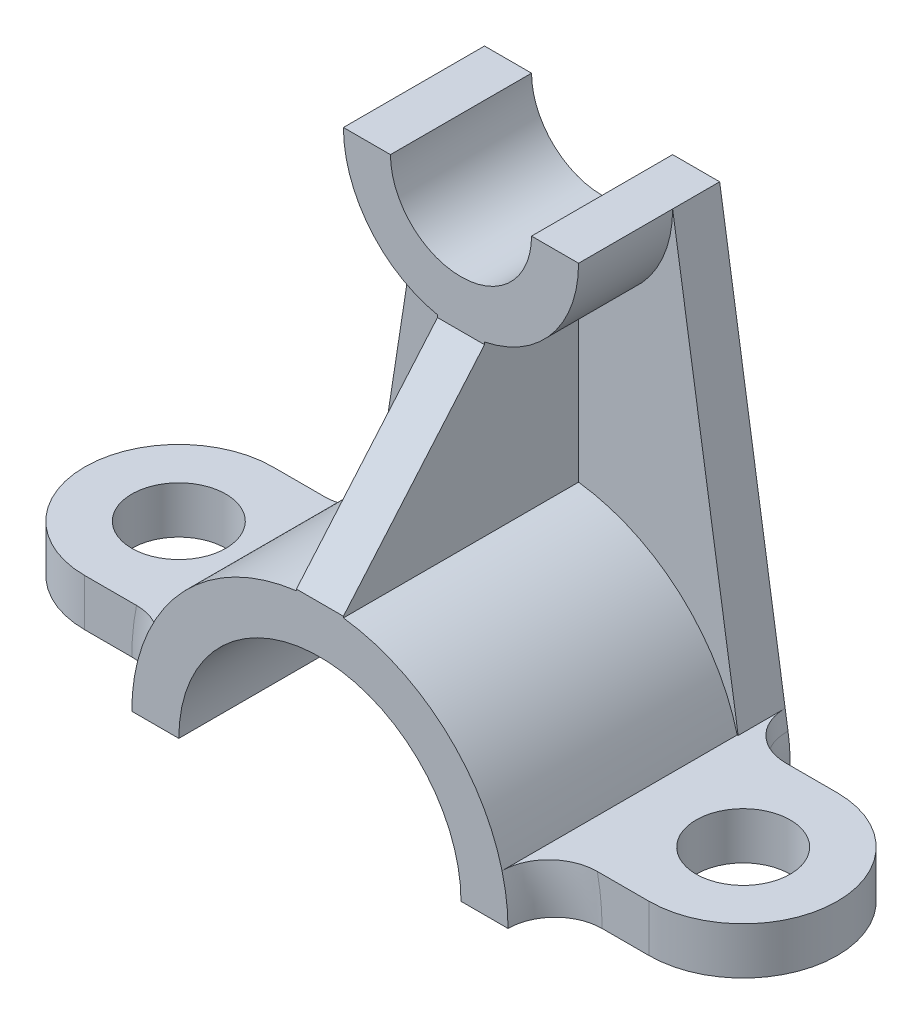
from build123d import *

# Parameters (mm, degrees)
BOSS_EXTRUDE2_DEPTH  = 1524
BOSS_EXTRUDE3_DEPTH  = 762
BOSS_EXTRUDE4_DEPTH  = 254
BOSS_EXTRUDE5_DEPTH  = 254
SKETCH5_R            = 254
CUT_EXTRUDE1_DEPTH   = 3418.220507957
FILLET1_R            = 254
FILLET1_OF_MIRROR1_R = 254
RIB3_START           = -127
RIB3_DEPTH           = 254


with BuildPart() as part:
    # Sketch1 → Boss-Extrude2 (new body)
    with BuildSketch(Plane.XY):
        with BuildLine():
            Line((1016, 0), (762, 0))
            ThreePointArc((762, 0), (0, 762), (-762, 0))
            Line((-762, 0), (-1016, 0))
            ThreePointArc((-1016, 0), (0, 1016), (1016, 0))
        make_face()
    extrude(amount=BOSS_EXTRUDE2_DEPTH)



with BuildPart() as body_2:
    # Sketch1<6> → Boss-Extrude3 (new body)
    with BuildSketch(Plane.XY):
        with BuildLine():
            Line((-635, 2540), (-381, 2540))
            ThreePointArc((-381, 2540), (0, 2159), (381, 2540))
            Line((381, 2540), (635, 2540))
            ThreePointArc((635, 2540), (0, 1905), (-635, 2540))
        make_face()
    extrude(amount=BOSS_EXTRUDE3_DEPTH)


with BuildPart() as part_1:
    add(part.part)

    add(body_2.part)  # Boss-Extrude4 merges body 2
    # Sketch2 → Boss-Extrude4 (add)
    with BuildSketch(Plane(origin=(0, 0, 0), x_dir=(-1, 0, 0), z_dir=(0, 0, -1))):
        with BuildLine():
            Line((-635, 2540), (-1004.047058824, 155.388235294))
            ThreePointArc((-1004.047058824, 155.388235294), (0, 1016), (1004.047058824, 155.388235294))
            Line((1004.047058824, 155.388235294), (635, 2540))
            ThreePointArc((635, 2540), (0, 1905), (-635, 2540))
        make_face()
    extrude(amount=-BOSS_EXTRUDE4_DEPTH)

    # Sketch3 → Boss-Extrude5 (add)
    with BuildSketch(Plane.XZ):
        with BuildLine():
            Line((1524, 254), (908.235803169, 254))
            Line((908.235803169, 254), (908.235803169, 1270))
            Line((908.235803169, 1270), (1524, 1270))
            ThreePointArc((1524, 1270), (2032, 762), (1524, 254))
        make_face()
    boss_extrude5 = extrude(amount=-BOSS_EXTRUDE5_DEPTH)

    # Sketch5 → Cut-Extrude1 (cut, through all)
    with BuildSketch(Plane(origin=(0, 254, 0), x_dir=(1, 0, 0), z_dir=(0, 1, 0))):
        with Locations(Location((1524, -762, 0), (0, 0, 270))):
            Circle(SKETCH5_R)
    cut_extrude1 = extrude(amount=-CUT_EXTRUDE1_DEPTH, mode=Mode.SUBTRACT)

    # Fillet1
    fillet1_edges = [part_1.edges().sort_by_distance(p)[0] for p in [
        (996.416386555, 204.694117647, 254),
        (1013.00735727, 77.923642867, 254),
        (1007.902171407, 128.020361162, 1270),
    ]]
    fillet(fillet1_edges, radius=FILLET1_R - 0.0001)  # a hair under: the kernel refuses the full size

    # Mirror1: Boss-Extrude5, Cut-Extrude1 across plane
    add(boss_extrude5.mirror(Plane(origin=(0, 0, 0), x_dir=(0, 0, 1), z_dir=(1, 0, 0))))
    add(cut_extrude1.mirror(Plane(origin=(0, 0, 0), x_dir=(0, 0, 1), z_dir=(1, 0, 0))), mode=Mode.SUBTRACT)

    # Fillet1 of Mirror1
    fillet1_of_mirror1_edges = [part_1.edges().sort_by_distance(p)[0] for p in [
        (-996.416386555, 204.694117647, 254),
        (-1013.00735727, 77.923642867, 254),
        (-1007.902171407, 128.020361162, 1270),
    ]]
    fillet(fillet1_of_mirror1_edges, radius=FILLET1_OF_MIRROR1_R - 0.0001)  # a hair under: the kernel refuses the full size

    # Rib3: read off the stored shape, not the designer's step
    # Rib3 outline → Rib3 (add)
    with BuildSketch(Plane(origin=(0, 0, 0), x_dir=(0, 0, -1), z_dir=(1, 0, 0)).offset(RIB3_START)):
        Polygon((-1524, 1016), (-1524, 1008.031249516), (-254, 1008.031249516), (-254, 1917.829605333), (-762, 1917.829605333), (-762, 1905), align=None)
    extrude(amount=RIB3_DEPTH)


solid = part_1.part
